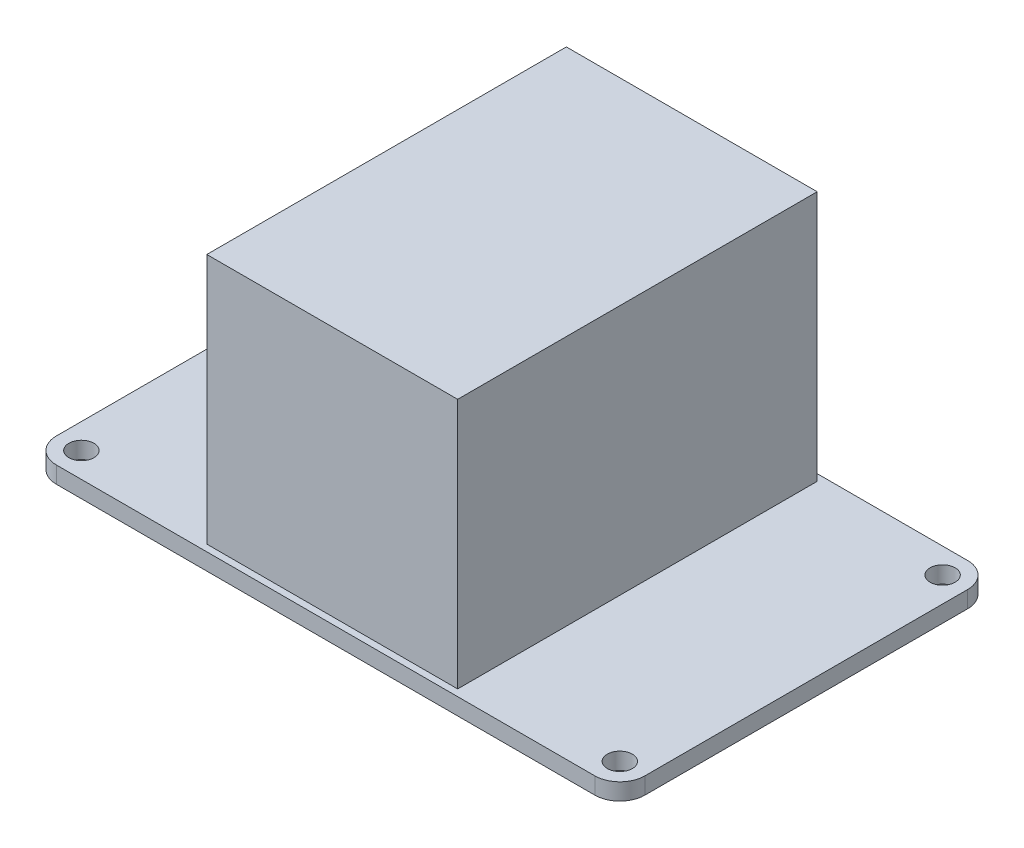
from build123d import *

# Parameters (mm, degrees)
SKETCH1_W           = 70.4
SKETCH1_H           = 44.6
BOSS_EXTRUDE1_DEPTH = 2
SKETCH3_R           = 1.5
CUT_EXTRUDE1_DEPTH  = 42.717262614
FILLET1_R           = 3
SKETCH4_W           = 30
SKETCH4_H           = 43
BOSS_EXTRUDE2_DEPTH = 30


with BuildPart() as part:
    # Sketch1 → Boss-Extrude1 (new body)
    with BuildSketch(Plane(origin=(0, 0, 0), x_dir=(1, 0, 0), z_dir=(0, 1, 0))):
        Rectangle(SKETCH1_W, SKETCH1_H)
    extrude(amount=BOSS_EXTRUDE1_DEPTH)

    # Sketch3 → Cut-Extrude1 (cut, through all)
    with BuildSketch(Plane(origin=(0, 2, 0), x_dir=(1, 0, 0), z_dir=(0, 1, 0))):
        with Locations((-32.2, 19.3)):
            Circle(SKETCH3_R)
        with Locations((32.2, 19.3)):
            Circle(SKETCH3_R)
        with Locations((32.2, -19.3)):
            Circle(SKETCH3_R)
        with Locations((-32.2, -19.3)):
            Circle(SKETCH3_R)
    extrude(amount=-CUT_EXTRUDE1_DEPTH, mode=Mode.SUBTRACT)

    # Fillet1
    fillet1_edges = [part.edges().sort_by_distance(p)[0] for p in [
        (35.2, 1, -22.3),
        (35.2, 1, 22.3),
        (-35.2, 1, -22.3),
        (-35.2, 1, 22.3),
    ]]
    fillet(fillet1_edges, radius=FILLET1_R)

    # Sketch4 → Boss-Extrude2 (add)
    with BuildSketch(Plane(origin=(0, 2, 0), x_dir=(1, 0, 0), z_dir=(0, 1, 0))):
        Rectangle(SKETCH4_W, SKETCH4_H)
    extrude(amount=BOSS_EXTRUDE2_DEPTH)


solid = part.part
